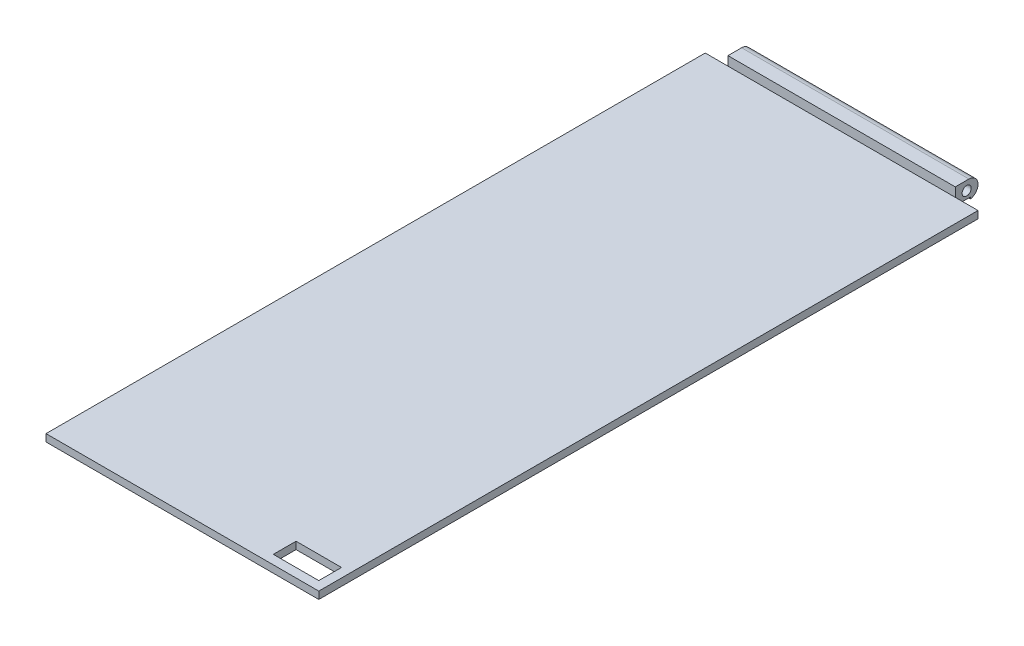
from build123d import *

# Parameters (mm, degrees)
SKETCH1_W           = 30
SKETCH1_H           = 70
BOSS_EXTRUDE1_DEPTH = 1
SKETCH2_W           = 30
SKETCH2_H           = 2.5
BOSS_EXTRUDE2_DEPTH = 1
SKETCH3_R           = 0.5
CUT_EXTRUDE1_DEPTH  = 30
SKETCH4_W           = 2.5
SKETCH4_H           = 2
CUT_EXTRUDE2_DEPTH  = 2.5
FILLET1_R           = 1
SKETCH5_W           = 30
SKETCH5_H           = 1
BOSS_EXTRUDE3_DEPTH = 5
FILLET2_R           = 1
SKETCH6_W           = 5
SKETCH6_H           = 2.5
CUT_EXTRUDE3_DEPTH  = 1
SKETCH7_W           = 30
SKETCH7_H           = 74.158210877
CUT_EXTRUDE4_DEPTH  = 0.2


with BuildPart() as part:
    # Sketch1 → Boss-Extrude1 (new body)
    with BuildSketch(Plane(origin=(0, 0, 0), x_dir=(1, 0, 0), z_dir=(0, 1, 0))):
        Rectangle(SKETCH1_W, SKETCH1_H)
    extrude(amount=BOSS_EXTRUDE1_DEPTH)

    # Sketch2 → Boss-Extrude2 (add)
    with BuildSketch(Plane(origin=(0, 1, 0), x_dir=(1, 0, 0), z_dir=(0, 1, 0))):
        with Locations((0, 33.75)):
            Rectangle(SKETCH2_W, SKETCH2_H)
    extrude(amount=BOSS_EXTRUDE2_DEPTH)

    # Sketch3 → Cut-Extrude1 (cut)
    with BuildSketch(Plane(origin=(15, 0, 0), x_dir=(0, 0, -1), z_dir=(1, 0, 0))):
        with Locations((33.75, 1)):
            Circle(SKETCH3_R)
    extrude(amount=-CUT_EXTRUDE1_DEPTH, mode=Mode.SUBTRACT)

    # Sketch4 → Cut-Extrude2 (cut)
    with BuildSketch(Plane(origin=(0, 0, -35), x_dir=(-1, 0, 0), z_dir=(0, 0, -1))):
        with Locations((-13.75, 1)):
            Rectangle(SKETCH4_W, SKETCH4_H)
        with Locations((13.75, 1)):
            Rectangle(SKETCH4_W, SKETCH4_H)
    extrude(amount=-CUT_EXTRUDE2_DEPTH, mode=Mode.SUBTRACT)

    # Fillet1
    fillet1_edges = [part.edges().sort_by_distance(p)[0] for p in [
        (0, 2, -35),
    ]]
    fillet(fillet1_edges, radius=FILLET1_R)

    # Sketch5 → Boss-Extrude3 (add)
    with BuildSketch(Plane.XY.offset(35)):
        with Locations((0, 0.5)):
            Rectangle(SKETCH5_W, SKETCH5_H)
    extrude(amount=BOSS_EXTRUDE3_DEPTH)

    # Fillet2
    fillet2_edges = [part.edges().sort_by_distance(p)[0] for p in [
        (0, 0, -35),
    ]]
    fillet(fillet2_edges, radius=FILLET2_R - 0.0001)  # a hair under: the kernel refuses the full size

    # Sketch6 → Cut-Extrude3 (cut)
    with BuildSketch(Plane(origin=(0, 1, 0), x_dir=(1, 0, 0), z_dir=(0, 1, 0))):
        with Locations((11.5, -37.75)):
            Rectangle(SKETCH6_W, SKETCH6_H)
    extrude(amount=-CUT_EXTRUDE3_DEPTH, mode=Mode.SUBTRACT)

    # Sketch7 → Cut-Extrude4 (cut)
    with BuildSketch(Plane.XZ):
        with Locations((0, 2.920894561)):
            Rectangle(SKETCH7_W, SKETCH7_H)
    extrude(amount=-CUT_EXTRUDE4_DEPTH, mode=Mode.SUBTRACT)


solid = part.part
